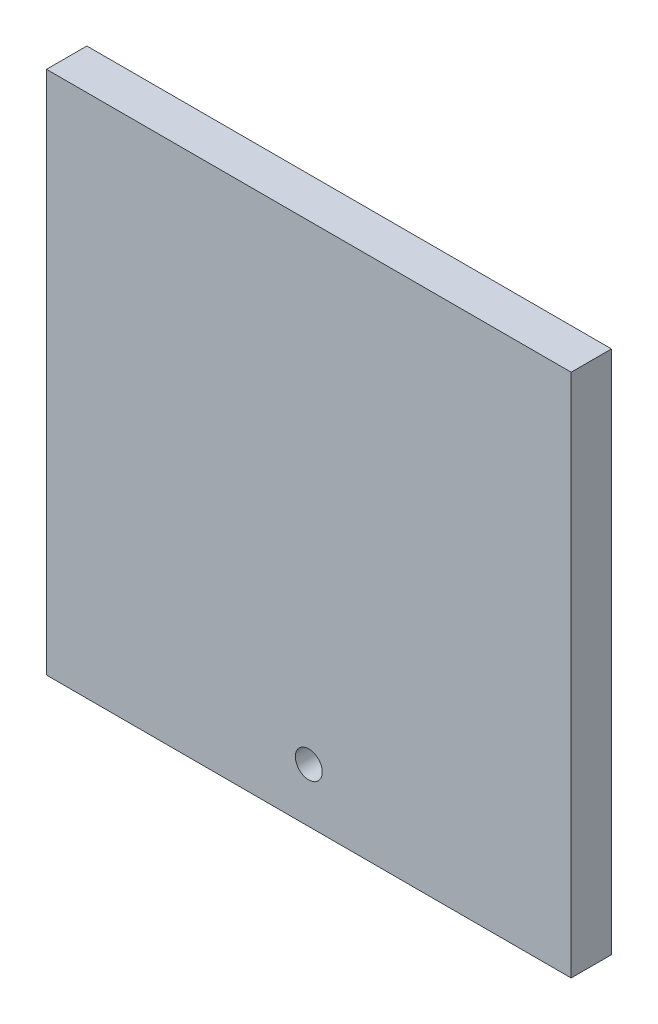
from build123d import *

# Parameters (mm, degrees)
SKETCH1_W           = 78
SKETCH1_H           = 78
BOSS_EXTRUDE1_DEPTH = 6
SKETCH2_R           = 2
CUT_EXTRUDE1_DEPTH  = 56.479726027


with BuildPart() as part:
    # Sketch1 → Boss-Extrude1 (new body)
    with BuildSketch(Plane.XY):
        Rectangle(SKETCH1_W, SKETCH1_H)
    extrude(amount=BOSS_EXTRUDE1_DEPTH)

    # Sketch2 → Cut-Extrude1 (cut, through all)
    with BuildSketch(Plane(origin=(0, 0, 0), x_dir=(-1, 0, 0), z_dir=(0, 0, -1))):
        with Locations((0, -31)):
            Circle(SKETCH2_R)
    extrude(amount=-CUT_EXTRUDE1_DEPTH, mode=Mode.SUBTRACT)


solid = part.part
